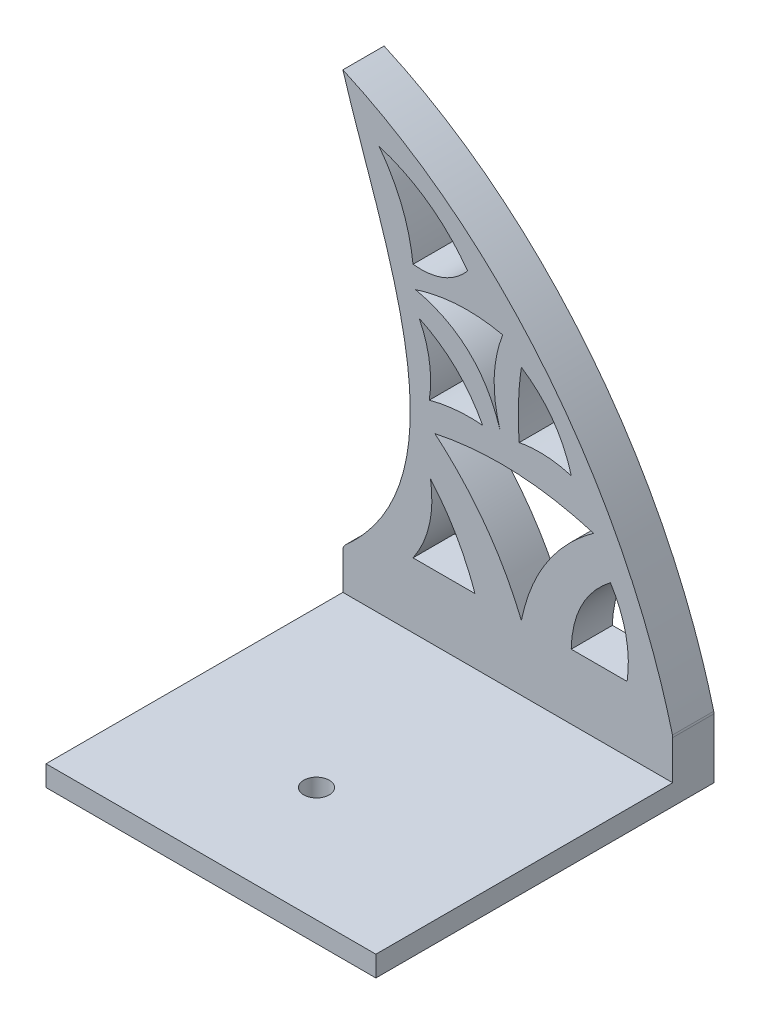
from build123d import *

# Parameters (mm, degrees)
SKETCH1_W           = 101.6
SKETCH1_H           = 152.4
BOSS_EXTRUDE1_DEPTH = 12.7
BOSS_EXTRUDE3_DEPTH = 12.7
FILLET1_R           = 2.54
FILLET2_R           = 5.08
CUT_EXTRUDE2_DEPTH  = 298.570512784
SKETCH8_W           = 101.6
SKETCH8_H           = 6.35
BOSS_EXTRUDE4_DEPTH = 91.44
SKETCH9_R           = 3.937
CUT_EXTRUDE3_DEPTH  = 202.484932954


with BuildPart() as part:
    # Sketch1 → Boss-Extrude1 (new body)
    with BuildSketch(Plane.XY):
        with Locations((50.8, 76.2)):
            Rectangle(SKETCH1_W, SKETCH1_H)
    extrude(amount=BOSS_EXTRUDE1_DEPTH)

    # Sketch2 → Boss-Extrude3 (add)
    with BuildSketch(Plane.XY):
        with BuildLine():
            add(Edge.make_bspline(
                [(0, 152.4), (39.790111277, 186.839065643), (12.30975625, 238.845497073), (0, 279.4)],
                knots=[0, 0, 0, 0, 1, 1, 1, 1], degree=3))
            Line((0, 152.4), (101.6, 152.4))
            add(Edge.make_bspline(
                [(0, 279.4), (51.286050257, 256.550041835), (87.836892382, 205.957944637), (101.6, 152.4)],
                knots=[0, 0, 0, 0, 1, 1, 1, 1], degree=3))
        make_face()
        with BuildLine():
            add(Edge.make_bspline(
                [(26.980466376, 183.81374211), (36.13847285, 173.175056715), (40.676641776, 160.02)],
                knots=[0, 0, 0, 1, 1, 1], degree=2))
            Line((40.676641776, 160.02), (21.602944743, 160.02))
            add(Edge.make_bspline(
                [(26.980466376, 183.81374211), (28.958775605, 170.837543608), (21.602944743, 160.02)],
                knots=[0, 0, 0, 1, 1, 1], degree=2))
        make_face(mode=Mode.SUBTRACT)
        with BuildLine():
            add(Edge.make_bspline(
                [(23.516066372, 224.861937296), (28.235295407, 215.21927262), (26.605728117, 204.582177714)],
                knots=[0, 0, 0, 1, 1, 1], degree=2))
            add(Edge.make_bspline(
                [(43.05348098, 206.08803494), (36.239789994, 218.91266054), (23.516066372, 224.861937296)],
                knots=[0, 0, 0, 1, 1, 1], degree=2))
            add(Edge.make_bspline(
                [(26.605728117, 204.582177714), (34.700432609, 206.792891754), (43.05348098, 206.08803494)],
                knots=[0, 0, 0, 1, 1, 1], degree=2))
        make_face(mode=Mode.SUBTRACT)
        with BuildLine():
            add(Edge.make_bspline(
                [(54.97708308, 160.02), (59.374728895, 181.400643158), (77.187204495, 194.363538628)],
                knots=[0, 0, 0, 1, 1, 1], degree=2))
            add(Edge.make_bspline(
                [(54.97708308, 160.02), (46.08347584, 181.54755316), (28.342136903, 196.529802482)],
                knots=[0, 0, 0, 1, 1, 1], degree=2))
            add(Edge.make_bspline(
                [(28.342136903, 196.529802482), (53.017815002, 201.732288521), (77.187204495, 194.363538628)],
                knots=[0, 0, 0, 1, 1, 1], degree=2))
        make_face(mode=Mode.SUBTRACT)
        with BuildLine():
            Line((87.546521436, 160.02), (70.32777317, 160.02))
            add(Edge.make_bspline(
                [(82.396089655, 183.81371778), (70.6713649, 174.663598784), (70.32777317, 160.02)],
                knots=[0, 0, 0, 1, 1, 1], degree=2))
            add(Edge.make_bspline(
                [(82.396089655, 183.81371778), (89.339550367, 172.773814043), (87.546521436, 160.02)],
                knots=[0, 0, 0, 1, 1, 1], degree=2))
        make_face(mode=Mode.SUBTRACT)
        with BuildLine():
            add(Edge.make_bspline(
                [(48.400350721, 207.535437601), (44.393568943, 220.734513873), (49.225838487, 233.315766274)],
                knots=[0, 0, 0, 1, 1, 1], degree=2))
            add(Edge.make_bspline(
                [(48.400350721, 207.535437601), (42.054170901, 227.566198031), (22.375615267, 231.937259722)],
                knots=[0, 0, 0, 1, 1, 1], degree=2))
            add(Edge.make_bspline(
                [(49.225838487, 233.315766274), (35.641228944, 236.267866949), (22.375615267, 231.937259722)],
                knots=[0, 0, 0, 1, 1, 1], degree=2))
        make_face(mode=Mode.SUBTRACT)
        with BuildLine():
            add(Edge.make_bspline(
                [(21.602944743, 238.323137826), (31.864782779, 237.284469605), (38.412267282, 244.949944056)],
                knots=[0, 0, 0, 1, 1, 1], degree=2))
            add(Edge.make_bspline(
                [(21.602944743, 238.323137826), (19.95197567, 252.974545225), (11.094737768, 264.601494061)],
                knots=[0, 0, 0, 1, 1, 1], degree=2))
            add(Edge.make_bspline(
                [(11.094737768, 264.601494061), (28.053835186, 259.295838115), (38.412267282, 244.949944056)],
                knots=[0, 0, 0, 1, 1, 1], degree=2))
        make_face(mode=Mode.SUBTRACT)
        with BuildLine():
            add(Edge.make_bspline(
                [(54.287141362, 207.109917469), (53.482096811, 217.391663167), (54.97708308, 227.557269012)],
                knots=[0, 0, 0, 1, 1, 1], degree=2))
            add(Edge.make_bspline(
                [(54.97708308, 227.557269012), (66.645859754, 219.852180834), (70.328259561, 206.277457578)],
                knots=[0, 0, 0, 1, 1, 1], degree=2))
            add(Edge.make_bspline(
                [(70.328259561, 206.277457578), (62.361576962, 208.669014941), (54.287141362, 207.109917469)],
                knots=[0, 0, 0, 1, 1, 1], degree=2))
        make_face(mode=Mode.SUBTRACT)
    extrude(amount=BOSS_EXTRUDE3_DEPTH)

    # Fillet1
    fillet1_edges = [part.edges().sort_by_distance(p)[0] for p in [
        (101.6, 152.4, 6.35),
        (0, 152.4, 6.35),
    ]]
    fillet(fillet1_edges, radius=FILLET1_R)

    # Fillet2
    fillet2_edges = [part.edges().sort_by_distance(p)[0] for p in [
        (101.6, 0, 6.35),
        (0, 0, 6.35),
    ]]
    fillet(fillet2_edges, radius=FILLET2_R)

    # Sketch5 → Cut-Extrude2 (cut, through all)
    with BuildSketch(Plane.XY.offset(12.7)):
        with BuildLine():
            Line((101.6, 133.663922723), (101.519048921, 133.663922723))
            Line((101.519048921, 133.663922723), (0, 133.663922723))
            Line((0, 133.663922723), (0, 5.08))
            ThreePointArc((0, 5.08), (1.487897552, 1.487897552), (5.08, 0))
            Line((5.08, 0), (96.52, 0))
            ThreePointArc((96.52, 0), (100.112102448, 1.487897552), (101.6, 5.08))
            Line((101.6, 5.08), (101.6, 133.663922723))
        make_face()
    extrude(amount=-CUT_EXTRUDE2_DEPTH, mode=Mode.SUBTRACT)

    # Sketch8 → Boss-Extrude4 (add)
    with BuildSketch(Plane.XY.offset(12.7)):
        with Locations((50.8, 136.838922723)):
            Rectangle(SKETCH8_W, SKETCH8_H)
    extrude(amount=BOSS_EXTRUDE4_DEPTH)

    # Sketch9 → Cut-Extrude3 (cut, through all)
    with BuildSketch(Plane(origin=(0, 140.013922723, 0), x_dir=(1, 0, 0), z_dir=(0, 1, 0))):
        with Locations((48.006, -68.834)):
            Circle(SKETCH9_R)
    extrude(amount=-CUT_EXTRUDE3_DEPTH, mode=Mode.SUBTRACT)


solid = part.part
